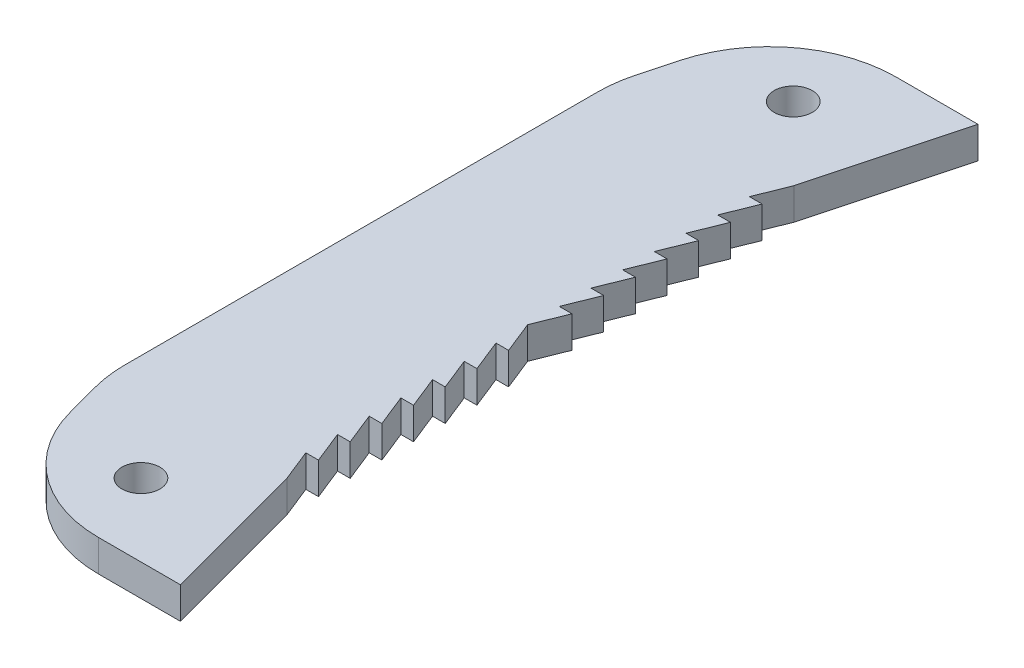
from build123d import *

# Parameters (mm, degrees)
SKETCH1_3_R         = 1.5
BOSS_EXTRUDE2_DEPTH = 2.5
FILLET1_R           = 10


with BuildPart() as part:
    # Sketch1<3> → Boss-Extrude2 (new body)
    with BuildSketch(Plane(origin=(0, 0, 0), x_dir=(1, 0, 0), z_dir=(0, 1, 0))):
        Polygon((-21.607428337, 0), (-18.535533906, -11.464466094), (-4.393398282, -11.464466094), (-7.465292714, 0), (-8.465292714, 2.5), (-7.465292714, 2.5), (-8.465292714, 5), (-7.465292714, 5), (-8.465292714, 7.5), (-7.465292714, 7.5), (-8.465292714, 10), (-7.465292714, 10), (-8.465292714, 12.5), (-7.465292714, 12.5), (-8.465292714, 15), (-7.465292714, 15), (-8.465292714, 17.5), (-7.465292714, 17.5), (-8.465292714, 20), (-7.465292714, 22.5), (-8.465292714, 22.5), (-7.465292714, 25), (-8.465292714, 25), (-7.465292714, 27.5), (-8.465292714, 27.5), (-7.465292714, 30), (-8.465292714, 30), (-7.465292714, 32.5), (-8.465292714, 32.5), (-7.465292714, 35), (-8.465292714, 35), (-7.465292714, 37.5), (-8.465292714, 37.5), (-7.465292714, 40), (-4.393398282, 51.464466094), (-18.535533906, 51.464466094), (-21.607428337, 40), align=None)
        with Locations((-13.241481122, -5.732233047)):
            Circle(SKETCH1_3_R, mode=Mode.SUBTRACT)
        with Locations((-13.241481122, 45.732233047)):
            Circle(SKETCH1_3_R, mode=Mode.SUBTRACT)
    extrude(amount=BOSS_EXTRUDE2_DEPTH)

    # Fillet1
    fillet1_edges = [part.edges().sort_by_distance(p)[0] for p in [
        (-18.535533906, 1.25, 11.464466094),
        (-21.607428337, 1.25, 0),
        (-21.607428337, 1.25, -40),
        (-18.535533906, 1.25, -51.464466094),
    ]]
    fillet(fillet1_edges, radius=FILLET1_R)


solid = part.part
